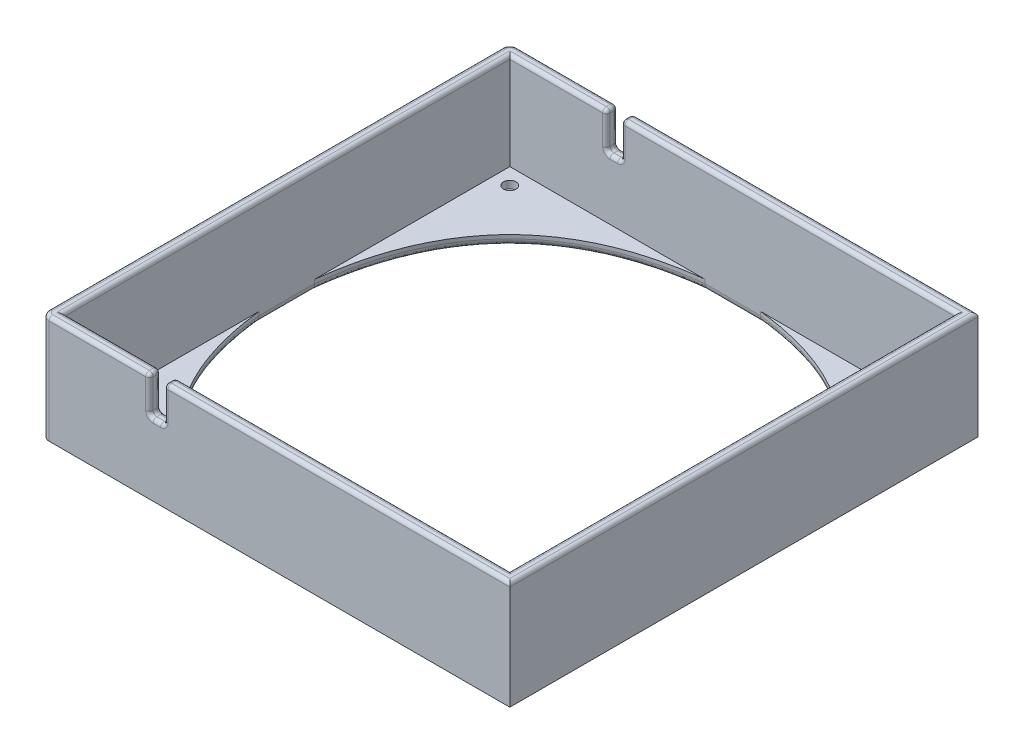
from build123d import *

# Parameters (mm, degrees)
SKETCH1_W               = 126
SKETCH1_H               = 126
BOSS_EXTRUDE3_DEPTH     = 29
CUT_EXTRUDE1_DEPTH      = 94.696317964
CUT_EXTRUDE1_DEPTH_BACK = 94.696317964
SKETCH2_W               = 120
SKETCH2_H               = 120
RIB11_DEPTH             = 3
MIRROR4_COPY_1_DEPTH    = 3
SKETCH7_R               = 1.7
CUT_EXTRUDE2_DEPTH      = 93.811637337
MIRROR6_COPY_1_SKETCH_R = 1.7
MIRROR6_COPY_1_DEPTH    = 93.811637337
FILLET2_R               = 2
FILLET3_R               = 2
FILLET5_R               = 1
CUT_EXTRUDE3_DEPTH      = 142.205524103
CUT_EXTRUDE3_DEPTH_BACK = 142.205524103
SKETCH8_W               = 4
SKETCH8_H               = 10
FILLET6_R               = 1
FILLET7_R               = 1
CUT_EXTRUDE4_DEPTH      = 94.696318098
CUT_EXTRUDE4_DEPTH_BACK = 1
SKETCH9_R               = 3.525


# Read off the part's stored shape, not the designer's step: Rib11
with BuildPart() as part:
    # Sketch1 → Boss-Extrude3 (new body)
    with BuildSketch(Plane(origin=(0, 0, 0), x_dir=(1, 0, 0), z_dir=(0, 1, 0))):
        Rectangle(SKETCH1_W, SKETCH1_H)
    extrude(amount=BOSS_EXTRUDE3_DEPTH)

    # Sketch2 → Cut-Extrude1 (cut, two sides: drawn at the far end of the back side and taken through both)
    with BuildSketch(Plane(origin=(0, 0, 0), x_dir=(1, 0, 0), z_dir=(0, 1, 0)).offset(-CUT_EXTRUDE1_DEPTH_BACK)):
        Rectangle(SKETCH2_W, SKETCH2_H)
    extrude(amount=CUT_EXTRUDE1_DEPTH + CUT_EXTRUDE1_DEPTH_BACK, mode=Mode.SUBTRACT)

    # Rib11 outline → Rib11 (add)
    with BuildSketch(Plane(origin=(0, 0, 0), x_dir=(1, 0, 0), z_dir=(0, 1, 0))):
        with BuildLine():
            add(Edge.make_bspline(
                [(-60, -7.5), (-54.571616203, -54.571616203), (-7.5, -60)],
                knots=[0, 0, 0, 1, 1, 1], degree=2))
            Line((-60, -7.5), (-60, -60))
            Line((-60, -60), (-7.5, -60))
        make_face()
    rib11 = extrude(amount=RIB11_DEPTH)

    # Mirror3: Rib11 across plane
    add(rib11.mirror(Plane(origin=(0, 0, 0), x_dir=(0, 0, 1), z_dir=(1, 0, 0))))

    # Mirror4: Rib11 across plane
    add(rib11.mirror(Plane.XY))

    # Mirror4 copy 1 sketch → Mirror4 copy 1 (add)
    with BuildSketch(Plane(origin=(0, 0, 0), x_dir=(-1, 0, 0), z_dir=(0, 1, 0))):
        with BuildLine():
            add(Edge.make_bspline(
                [(-60, -7.5), (-54.571616203, -54.571616203), (-7.5, -60)],
                knots=[0, 0, 0, 1, 1, 1], degree=2))
            Line((-60, -7.5), (-60, -60))
            Line((-60, -60), (-7.5, -60))
        make_face()
    extrude(amount=MIRROR4_COPY_1_DEPTH)

    # Sketch7 → Cut-Extrude2 (cut, symmetric)
    with BuildSketch(Plane(origin=(0, 3, 0), x_dir=(1, 0, 0), z_dir=(0, 1, 0))):
        with Locations(Location((55.6, 55.6, 0), (0, 0, 270))):
            Circle(SKETCH7_R)
    cut_extrude2 = extrude(amount=CUT_EXTRUDE2_DEPTH, both=True, mode=Mode.SUBTRACT)

    # Mirror5: Cut-Extrude2 across plane
    add(cut_extrude2.mirror(Plane.XY), mode=Mode.SUBTRACT)

    # Mirror6: Cut-Extrude2 across plane
    add(cut_extrude2.mirror(Plane(origin=(0, 0, 0), x_dir=(0, 0, 1), z_dir=(1, 0, 0))), mode=Mode.SUBTRACT)

    # Mirror6 copy 1 sketch → Mirror6 copy 1 (cut, symmetric)
    with BuildSketch(Plane(origin=(0, 3, 0), x_dir=(-1, 0, 0), z_dir=(0, 1, 0))):
        with Locations(Location((55.6, 55.6, 0), (0, 0, 270))):
            Circle(MIRROR6_COPY_1_SKETCH_R)
    extrude(amount=MIRROR6_COPY_1_DEPTH, both=True, mode=Mode.SUBTRACT)

    # Fillet2
    fillet2_edges = [part.edges().sort_by_distance(p)[0] for p in [
        (0, 0, -60),
        (44.160843525, 0, -44.160772678),
        (0, 0, 60),
        (-44.160843525, 0, 44.160772678),
        (44.160843525, 0, 44.160772678),
        (-60, 0, 0),
        (-44.160843525, 0, -44.160772678),
    ]]
    fillet(fillet2_edges, radius=FILLET2_R)

    # Fillet3
    fillet3_edges = [part.edges().sort_by_distance(p)[0] for p in [
        (-63, 14.5, 63),
        (-63, 14.5, -63),
    ]]
    fillet(fillet3_edges, radius=FILLET3_R)

    # Fillet5
    fillet5_edges = [part.edges().sort_by_distance(p)[0] for p in [
        (-63, 29, 0),
        (1, 29, 63),
        (-62.414213562, 29, 62.414213562),
        (-62.414213562, 29, -62.414213562),
        (60, 29, 0),
        (0, 29, -60),
        (-60, 29, 0),
        (0, 29, 60),
        (63, 29, 0),
        (1, 29, -63),
    ]]
    fillet(fillet5_edges, radius=FILLET5_R)

    # Sketch8 → Cut-Extrude3 (cut, two sides: drawn at the far end of the back side and taken through both)
    with BuildSketch(Plane.XY.offset(-60).offset(-CUT_EXTRUDE3_DEPTH_BACK)):
        with Locations((-32, 24.197066212)):
            Rectangle(SKETCH8_W, SKETCH8_H)
    extrude(amount=CUT_EXTRUDE3_DEPTH + CUT_EXTRUDE3_DEPTH_BACK, mode=Mode.SUBTRACT)

    # Fillet6
    fillet6_edges = [part.edges().sort_by_distance(p)[0] for p in [
        (-34, 28.707106781, -62.707106781),
        (-30, 28.707106781, -62.707106781),
        (-32, 19.197066212, -63),
        (-30, 19.197066212, -61.5),
        (-32, 19.197066212, -60),
        (-30, 23.598533106, -60),
        (-30, 28.707106781, -60.292893219),
        (-30, 29, -61.5),
        (-34, 29, -61.5),
        (-34, 28.707106781, -60.292893219),
        (-34, 23.598533106, -60),
        (-30, 23.598533106, -63),
        (-34, 23.598533106, -63),
        (-34, 19.197066212, -61.5),
    ]]
    fillet(fillet6_edges, radius=FILLET6_R)

    # Fillet7
    fillet7_edges = [part.edges().sort_by_distance(p)[0] for p in [
        (-32, 19.197066212, 60),
        (-30, 19.197066212, 61.5),
        (-32, 19.197066212, 63),
        (-30, 28.707106781, 60.292893219),
        (-30, 23.598533106, 60),
        (-30, 28.707106781, 62.707106781),
        (-30, 29, 61.5),
        (-30, 23.598533106, 63),
        (-34, 23.598533106, 60),
        (-34, 28.707106781, 60.292893219),
        (-34, 29, 61.5),
        (-34, 28.707106781, 62.707106781),
        (-34, 19.197066212, 61.5),
        (-34, 23.598533106, 63),
    ]]
    fillet(fillet7_edges, radius=FILLET7_R)

    # Sketch9 → Cut-Extrude4 (cut, two sides: drawn at the far end of the back side and taken through both)
    with BuildSketch(Plane.XZ.offset(-CUT_EXTRUDE4_DEPTH_BACK)):
        with Locations(Location((-55.6, 55.6, 0), (0, 0, 90))):
            Circle(SKETCH9_R)
        with Locations(Location((55.6, 55.6, 0), (0, 0, 90))):
            Circle(SKETCH9_R)
        with Locations(Location((55.6, -55.6, 0), (0, 0, 90))):
            Circle(SKETCH9_R)
        with Locations(Location((-55.6, -55.6, 0), (0, 0, 90))):
            Circle(SKETCH9_R)
    extrude(amount=CUT_EXTRUDE4_DEPTH + CUT_EXTRUDE4_DEPTH_BACK, mode=Mode.SUBTRACT)


solid = part.part
